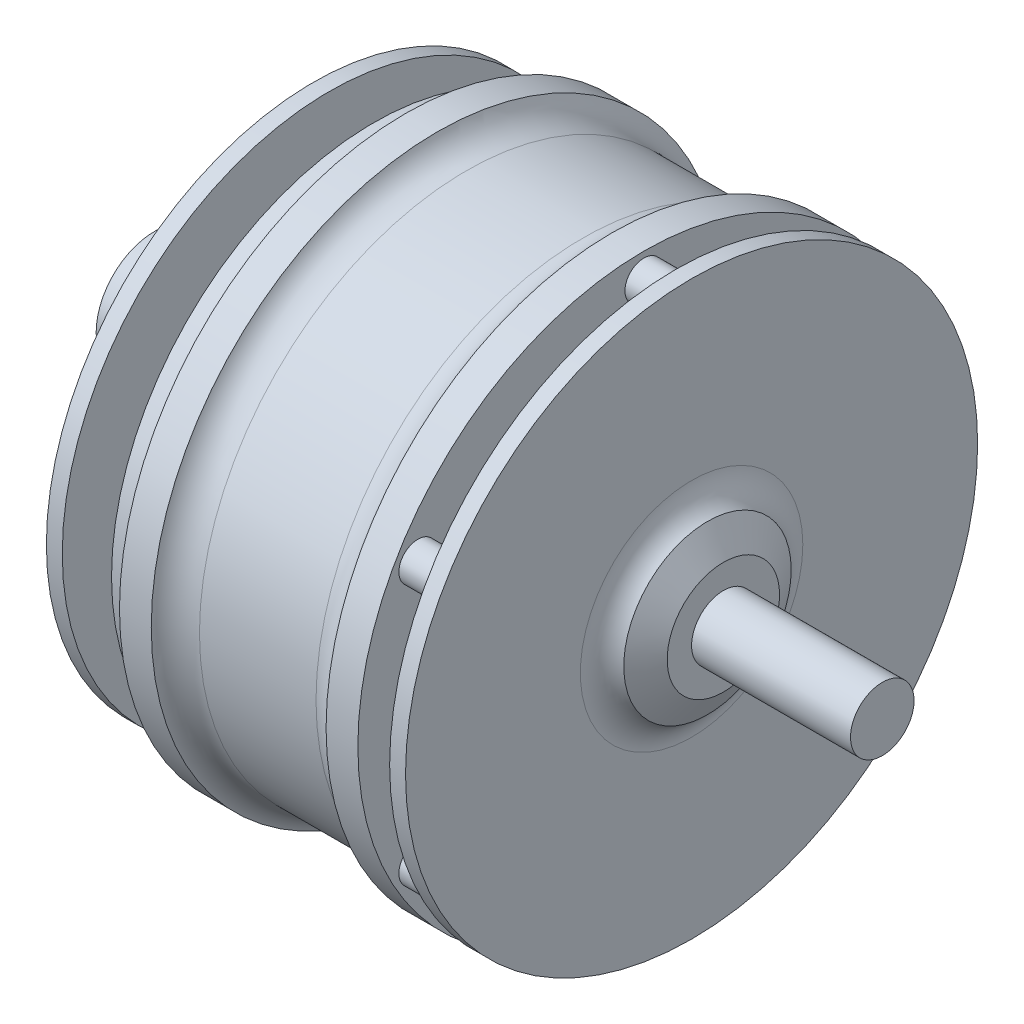
from build123d import *

# Parameters (mm, degrees)
SKETCH1_R            = 84
BOSS_EXTRUDE1_DEPTH  = 55
SKETCH2_R            = 90
BOSS_EXTRUDE2_DEPTH  = 10
BOSS_EXTRUDE3_START  = 10
SKETCH3_R            = 90
BOSS_EXTRUDE3_DEPTH  = 10
SKETCH4_R            = 82.5
BOSS_EXTRUDE4_DEPTH  = 10
SKETCH5_R            = 62.5
SKETCH6_R            = 45
SKETCH7_R            = 15
BOSS_EXTRUDE5_DEPTH  = 5
BOSS_EXTRUDE6_START  = 5
SKETCH8_R            = 84
BOSS_EXTRUDE6_DEPTH  = 5
SKETCH9_R            = 18.335958802
BOSS_EXTRUDE7_DEPTH  = 50
SKETCH10_R           = 5.965973997
BOSS_EXTRUDE8_DEPTH  = 10
CIRPATTERN1_COUNT    = 6
SKETCH11_R           = 90
BOSS_EXTRUDE9_DEPTH  = 5
SKETCH12_R           = 25
BOSS_EXTRUDE10_DEPTH = 10
FILLET3_R            = 10
FILLET4_R            = 10
SKETCH13_R           = 25
BOSS_EXTRUDE11_DEPTH = 10
SKETCH14_R           = 10
BOSS_EXTRUDE12_DEPTH = 50
FILLET6_R            = 10


with BuildPart() as part:
    # Sketch1 → Boss-Extrude1 (new body)
    with BuildSketch(Plane(origin=(0, 0, 0), x_dir=(0, 0, -1), z_dir=(1, 0, 0))):
        Circle(SKETCH1_R)
    extrude(amount=BOSS_EXTRUDE1_DEPTH)

    # Sketch2 → Boss-Extrude2 (add)
    with BuildSketch(Plane(origin=(55, 0, 0), x_dir=(0, 0, -1), z_dir=(1, 0, 0))):
        Circle(SKETCH2_R)
    extrude(amount=BOSS_EXTRUDE2_DEPTH)

    # Sketch3 → Boss-Extrude3 (add)
    with BuildSketch(Plane.ZY.offset(BOSS_EXTRUDE3_START)):
        with Locations(Location((0, 0, 0), (0, 0, 180))):
            Circle(SKETCH3_R)
    extrude(amount=-BOSS_EXTRUDE3_DEPTH)

    # Sketch4 → Boss-Extrude4 (add)
    with BuildSketch(Plane.ZY.offset(10)):
        Circle(SKETCH4_R)
    extrude(amount=BOSS_EXTRUDE4_DEPTH)

    # Sketch5 → Loft1 section 0
    with BuildSketch(Plane.ZY.offset(20)):
        Circle(SKETCH5_R)
    # Sketch6 → Loft1 section 1
    with BuildSketch(Plane.ZY.offset(29)):
        Circle(SKETCH6_R)
    loft()

    # Sketch7 → Boss-Extrude5 (add)
    with BuildSketch(Plane.ZY.offset(29)):
        Circle(SKETCH7_R)
    extrude(amount=BOSS_EXTRUDE5_DEPTH)

    # Sketch8 → Boss-Extrude6 (add)
    with BuildSketch(Plane.ZY.offset(34).offset(BOSS_EXTRUDE6_START)):
        Circle(SKETCH8_R)
    extrude(amount=-BOSS_EXTRUDE6_DEPTH)

    # Sketch9 → Boss-Extrude7 (add)
    with BuildSketch(Plane.ZY.offset(39)):
        Circle(SKETCH9_R)
    extrude(amount=BOSS_EXTRUDE7_DEPTH)

    # Sketch10 → Boss-Extrude8 (add)
    with BuildSketch(Plane(origin=(65, 0, 0), x_dir=(0, 0, -1), z_dir=(1, 0, 0))):
        with Locations((0, 82.122651967)):
            Circle(SKETCH10_R)
    boss_extrude8 = extrude(amount=BOSS_EXTRUDE8_DEPTH)

    # CirPattern1: Boss-Extrude8 ×6 about axis
    cirpattern1_axis = Axis((0, 0, 0), (1, 0, 0))
    for i in range(1, CIRPATTERN1_COUNT):
        add(boss_extrude8.rotate(cirpattern1_axis, i * 360 / CIRPATTERN1_COUNT))

    # Sketch11 → Boss-Extrude9 (add)
    with BuildSketch(Plane(origin=(75, 0, 0), x_dir=(0, 0, -1), z_dir=(1, 0, 0))):
        Circle(SKETCH11_R)
    extrude(amount=BOSS_EXTRUDE9_DEPTH)

    # Sketch12 → Boss-Extrude10 (add)
    with BuildSketch(Plane(origin=(65, 0, 0), x_dir=(0, 0, -1), z_dir=(1, 0, 0))):
        Circle(SKETCH12_R)
    extrude(amount=BOSS_EXTRUDE10_DEPTH)

    # Fillet3
    # the kernel refuses this fillet: 10 mm, written as the material it adds along each edge
    with BuildSketch(Plane(origin=(0, 0, 0), x_dir=(0, 0, -1), z_dir=(0, -1, 0))) as fillet3_piece_1:
        with BuildLine():
            CenterArc((94, 9.16515139), FILLET3_R, 180, 66.421821522)
            Line((90, 0), (89.92, -0.183303028))
            ThreePointArc((89.92, -0.183303028), (87, -0.2), (84, -0.2))
            Line((84, -0.2), (83.8, 0))
            Line((83.8, 0), (83.8, 9.16515139))
            Line((83.8, 9.16515139), (84, 9.16515139))
        make_face()
    revolve(axis=Axis((0, 0, 0), (1, 0, 0)))

    # Fillet4
    # the kernel refuses this fillet: 10 mm, written as the material it adds along each edge
    with BuildSketch(Plane(origin=(55, 0, 0), x_dir=(0, 0, -1), z_dir=(0, -1, 0))) as fillet4_piece_1:
        with BuildLine():
            CenterArc((94, -9.16515139), FILLET4_R, 113.578178478, 66.421821522)
            Line((90, 0), (89.92, 0.183303028))
            ThreePointArc((89.92, 0.183303028), (87, 0.2), (84, 0.2))
            Line((84, 0.2), (83.8, 0))
            Line((83.8, 0), (83.8, -9.16515139))
            Line((83.8, -9.16515139), (84, -9.16515139))
        make_face()
    revolve(axis=Axis((55, 0, 0), (1, 0, 0)))

    # Sketch13 → Boss-Extrude11 (add)
    with BuildSketch(Plane(origin=(80, 0, 0), x_dir=(0, 0, -1), z_dir=(1, 0, 0))):
        Circle(SKETCH13_R)
    extrude(amount=BOSS_EXTRUDE11_DEPTH)

    # Sketch14 → Boss-Extrude12 (add)
    with BuildSketch(Plane(origin=(90, 0, 0), x_dir=(0, 0, -1), z_dir=(1, 0, 0))):
        Circle(SKETCH14_R)
    extrude(amount=BOSS_EXTRUDE12_DEPTH)

    # Fillet6
    fillet6_edges = [part.edges().sort_by_distance(p)[0] for p in [
        (80, 0, 25),
    ]]
    fillet(fillet6_edges, radius=FILLET6_R - 0.0001)  # a hair under: the kernel refuses the full size

    # Chamfer1: read off the stored shape, not the designer's step
    # Chamfer1 outline → Chamfer1 (revolve, cut)
    with BuildSketch(Plane.YX):
        Polygon((26.339745962, 90), (17.679491924, 90), (26.339745962, 85), align=None)
    revolve(axis=Axis((0, 0, 0), (1, 0, 0)), mode=Mode.SUBTRACT)


solid = part.part
